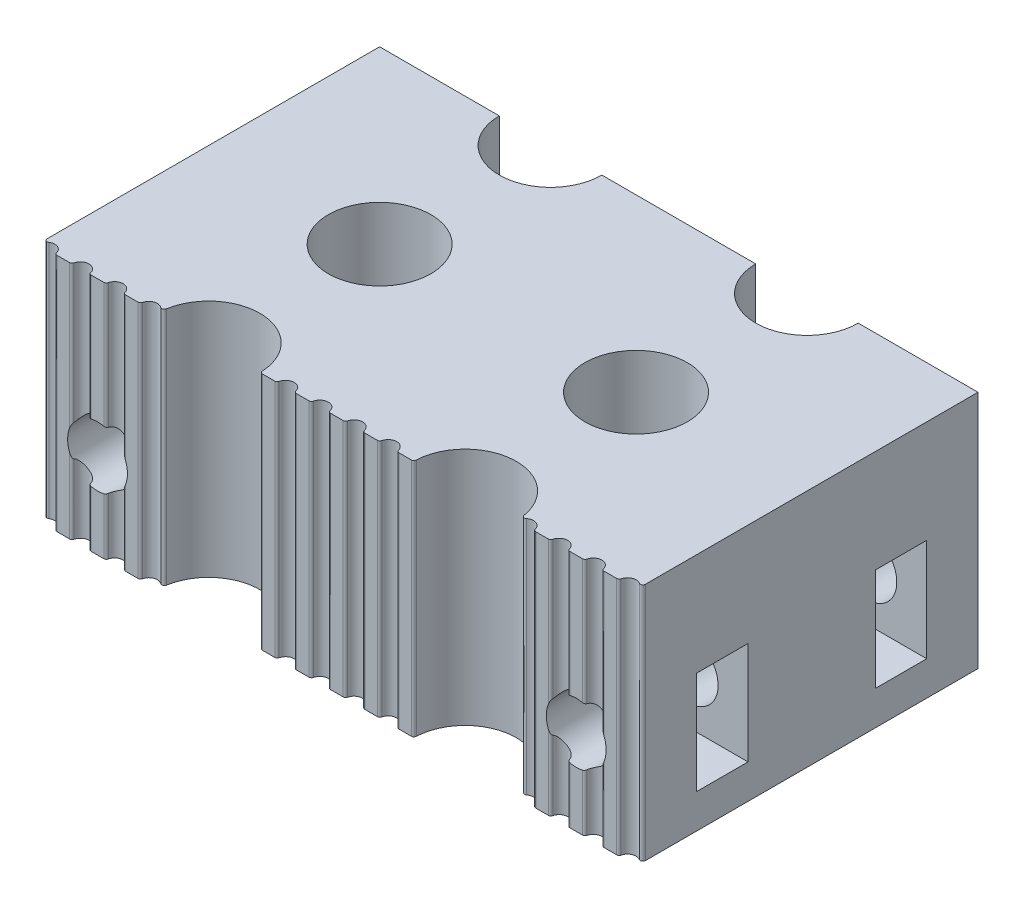
from build123d import *

# Parameters (mm, degrees)
SKETCH1_W           = 35
SKETCH1_H           = 20
BOSS_EXTRUDE1_DEPTH = 14
SKETCH2_R           = 3
CUT_EXTRUDE1_DEPTH  = 14
SKETCH3_R           = 0.5
CUT_EXTRUDE2_DEPTH  = 14
LPATTERN1_COUNT     = 18
LPATTERN1_PITCH     = 2
FILLET1_R           = 0.15
SKETCH5_R           = 1.75
CUT_EXTRUDE4_DEPTH  = 25.540782384
SKETCH7_R           = 1.75
CUT_EXTRUDE5_DEPTH  = 31.037476592
SKETCH8_R           = 3
CUT_EXTRUDE6_DEPTH  = 5
SKETCH9_W           = 3
SKETCH9_H           = 6
CUT_EXTRUDE7_DEPTH  = 7
SKETCH10_W          = 3
SKETCH10_H          = 6
CUT_EXTRUDE8_DEPTH  = 7


with BuildPart() as part:
    # Sketch1 → Boss-Extrude1 (new body)
    with BuildSketch(Plane(origin=(0, 0, 0), x_dir=(1, 0, 0), z_dir=(0, 1, 0))):
        Rectangle(SKETCH1_W, SKETCH1_H)
    extrude(amount=BOSS_EXTRUDE1_DEPTH)

    # Sketch2 → Cut-Extrude1 (cut)
    with BuildSketch(Plane(origin=(0, 14, 0), x_dir=(1, 0, 0), z_dir=(0, 1, 0))):
        with Locations((-7.5, -10)):
            Circle(SKETCH2_R)
        with Locations((7.5, -10)):
            Circle(SKETCH2_R)
        with Locations((-7.5, 10)):
            Circle(SKETCH2_R)
        with Locations((7.5, 10)):
            Circle(SKETCH2_R)
    extrude(amount=-CUT_EXTRUDE1_DEPTH, mode=Mode.SUBTRACT)

    # Sketch3 → Cut-Extrude2 (cut)
    with BuildSketch(Plane(origin=(0, 14, 0), x_dir=(1, 0, 0), z_dir=(0, 1, 0))):
        with Locations((-17, -10)):
            Circle(SKETCH3_R)
    cut_extrude2 = extrude(amount=-CUT_EXTRUDE2_DEPTH, mode=Mode.SUBTRACT)

    # LPattern1: Cut-Extrude2 ×18
    with Locations(*[(i * LPATTERN1_PITCH, 0, 0) for i in range(1, LPATTERN1_COUNT)]):
        add(cut_extrude2, mode=Mode.SUBTRACT)

    # Fillet1
    # the kernel refuses this fillet: 0.15 mm, written as the material it takes off along each edge
    with BuildSketch(Plane(origin=(-3.5, -0.33113883, 10), x_dir=(-1, 0, 0), z_dir=(0, 1, 0)), Plane(origin=(-1.5, -0.33113883, 10), x_dir=(-1, 0, 0), z_dir=(0, 1, 0)), Plane(origin=(0.5, -0.33113883, 10), x_dir=(-1, 0, 0), z_dir=(0, 1, 0)), Plane(origin=(2.5, -0.33113883, 10), x_dir=(-1, 0, 0), z_dir=(0, 1, 0)), Plane(origin=(12.5, -0.33113883, 10), x_dir=(-1, 0, 0), z_dir=(0, 1, 0)), Plane(origin=(14.5, -0.33113883, 10), x_dir=(-1, 0, 0), z_dir=(0, 1, 0)), Plane(origin=(16.5, -0.33113883, 10), x_dir=(-1, 0, 0), z_dir=(0, 1, 0)), Plane(origin=(-15.5, -0.33113883, 10), x_dir=(-1, 0, 0), z_dir=(0, 1, 0)), Plane(origin=(-13.5, -0.33113883, 10), x_dir=(-1, 0, 0), z_dir=(0, 1, 0)), Plane(origin=(-11.5, -0.33113883, 10), x_dir=(-1, 0, 0), z_dir=(0, 1, 0))) as fillet1_piece_1:
        with BuildLine():
            CenterArc((0.132455532, -0.15), FILLET1_R, 90, 76.657636203)
            ThreePointArc((-0.013495745, -0.115384615), (-0.003385397, -0.058085593), (0, 0))
            Line((0, 0), (0.132455532, 0))
        make_face()
    extrude(amount=14.66227766, mode=Mode.SUBTRACT)
    with BuildSketch(Plane(origin=(-2.5, 14.33113883, 10), x_dir=(-0.11617118657170943, 0, -0.9932292058787443), z_dir=(0, -1, 0)), Plane(origin=(-0.5, 14.33113883, 10), x_dir=(-0.11617118657171462, 0, -0.9932292058787437), z_dir=(0, -1, 0)), Plane(origin=(1.5, 14.33113883, 10), x_dir=(-0.11617118657171507, 0, -0.9932292058787436), z_dir=(0, -1, 0)), Plane(origin=(3.5, 14.33113883, 10), x_dir=(-0.11617118657170943, 0, -0.9932292058787443), z_dir=(0, -1, 0)), Plane(origin=(11.5, 14.33113883, 10), x_dir=(-0.11617118657171698, 0, -0.9932292058787435), z_dir=(0, -1, 0)), Plane(origin=(13.5, 14.33113883, 10), x_dir=(-0.11617118657171698, 0, -0.9932292058787435), z_dir=(0, -1, 0)), Plane(origin=(15.5, 14.33113883, 10), x_dir=(-0.11617118657171698, 0, -0.9932292058787435), z_dir=(0, -1, 0)), Plane(origin=(-16.5, 14.33113883, 10), x_dir=(-0.11617118657171698, 0, -0.9932292058787435), z_dir=(0, -1, 0)), Plane(origin=(-14.5, 14.33113883, 10), x_dir=(-0.11617118657171698, 0, -0.9932292058787435), z_dir=(0, -1, 0)), Plane(origin=(-12.5, 14.33113883, 10), x_dir=(-0.11617118657171698, 0, -0.9932292058787435), z_dir=(0, -1, 0))) as fillet1_piece_2:
        with BuildLine():
            CenterArc((0.133596865, 0.148984381), FILLET1_R, 186.671181899, 76.657636203)
            Line((-0.015387516, 0.131558703), (0, 0))
            ThreePointArc((0, 0), (0.058085593, 0.003385397), (0.116171187, 0))
        make_face()
    extrude(amount=14.66227766, mode=Mode.SUBTRACT)
    with BuildSketch(Plane(origin=(4.5, -0.366066361, 10), x_dir=(-1, 0, 0), z_dir=(0, 1, 0))) as fillet1_piece_3:
        with BuildLine():
            CenterArc((0.146426545, -0.15), FILLET1_R, 90, 87.270597363)
            ThreePointArc((-0.003403291, -0.142857143), (-0.000850943, -0.071448838), (0, 0))
            Line((0, 0), (0.146426545, 0))
        make_face()
    extrude(amount=14.732132723, mode=Mode.SUBTRACT)
    with BuildSketch(Plane(origin=(10.5, 15.237179148, 10), x_dir=(-0.0824786098842957, 0, -0.9965928350693448), z_dir=(0, -1, 0)), Plane(origin=(-10.5, -1.237179148, 10), x_dir=(0.08247860988429423, 0, -0.9965928350693448), z_dir=(0, 1, 0))) as fillet1_piece_4:
        with BuildLine():
            CenterArc((0.507243451, 0.149488925), FILLET1_R, 147.545688067, 117.723261309)
            ThreePointArc((0.380670507, 0.229982962), (0.21731401, 0.070335925), (0, 0))
            ThreePointArc((0, 0), (0.24743583, 0.010221495), (0.494871659, 0))
        make_face()
    extrude(amount=16.474358297, mode=Mode.SUBTRACT)
    with BuildSketch(Plane(origin=(-4.5, 14.366066361, 10), x_dir=(-0.023816279244888133, 0, -0.9997163521934256), z_dir=(0, -1, 0))) as fillet1_piece_5:
        with BuildLine():
            CenterArc((0.146470117, 0.149957453), FILLET1_R, 181.364701318, 87.270597363)
            Line((-0.003487335, 0.146385011), (0, 0))
            ThreePointArc((0, 0), (0.071448838, 0.000850943), (0.142897675, 0))
        make_face()
    extrude(amount=14.732132723, mode=Mode.SUBTRACT)
    with BuildSketch(Plane(origin=(17.5, -1.369306394, 10), x_dir=(-0.48038446141526975, 0, -0.8770580193070246), z_dir=(0, 1, 0))) as fillet1_piece_6:
        with BuildLine():
            CenterArc((0.552442131, -0.131558703), FILLET1_R, 118.710514804, 122.578970393)
            Line((0.480384461, -0.263117406), (0, 0))
            ThreePointArc((0, 0), (0.240192231, -0.06147099), (0.480384461, 0))
        make_face()
    extrude(amount=16.738612788, mode=Mode.SUBTRACT)
    with BuildSketch(Plane(origin=(-17.5, -1.369306394, 10), x_dir=(0, 0, -1), z_dir=(0, 1, 0))) as fillet1_piece_7:
        with BuildLine():
            CenterArc((0.547722558, -0.15), FILLET1_R, 90, 122.578970393)
            ThreePointArc((0.421325044, -0.230769231), (0.240192231, -0.06147099), (0, 0))
            Line((0, 0), (0.547722558, 0))
        make_face()
    extrude(amount=16.738612788, mode=Mode.SUBTRACT)

    # Sketch5 → Cut-Extrude4 (cut, through all)
    with BuildSketch(Plane(origin=(0, 14, 0), x_dir=(1, 0, 0), z_dir=(0, 1, 0))):
        with Locations(Location((-7.5, 0, 0), (0, 0, 270))):
            Circle(SKETCH5_R)
        with Locations(Location((7.5, 0, 0), (0, 0, 270))):
            Circle(SKETCH5_R)
    extrude(amount=-CUT_EXTRUDE4_DEPTH, mode=Mode.SUBTRACT)

    # Sketch7 → Cut-Extrude5 (cut, through all)
    with BuildSketch(Plane(origin=(0, 0, -10), x_dir=(-1, 0, 0), z_dir=(0, 0, -1))):
        with Locations((-14, 5)):
            Circle(SKETCH7_R)
        with Locations((14, 5)):
            Circle(SKETCH7_R)
    extrude(amount=-CUT_EXTRUDE5_DEPTH, mode=Mode.SUBTRACT)

    # Sketch8 → Cut-Extrude6 (cut)
    with BuildSketch(Plane(origin=(0, 14, 0), x_dir=(1, 0, 0), z_dir=(0, 1, 0))):
        with Locations(Location((7.5, 0, 0), (0, 0, 270))):
            Circle(SKETCH8_R)
        with Locations(Location((-7.5, 0, 0), (0, 0, 270))):
            Circle(SKETCH8_R)
    extrude(amount=-CUT_EXTRUDE6_DEPTH, mode=Mode.SUBTRACT)

    # Sketch9 → Cut-Extrude7 (cut)
    with BuildSketch(Plane(origin=(17.5, 0, 0), x_dir=(0, 0, -1), z_dir=(1, 0, 0))):
        with Locations((5.5, 5)):
            Rectangle(SKETCH9_W, SKETCH9_H)
        with Locations((-4.952277442, 5)):
            Rectangle(SKETCH9_W, SKETCH9_H)
    extrude(amount=-CUT_EXTRUDE7_DEPTH, mode=Mode.SUBTRACT)

    # Sketch10 → Cut-Extrude8 (cut)
    with BuildSketch(Plane.ZY.offset(17.5)):
        with Locations((4.952277442, 5)):
            Rectangle(SKETCH10_W, SKETCH10_H)
        with Locations((-5.5, 5)):
            Rectangle(SKETCH10_W, SKETCH10_H)
    extrude(amount=-CUT_EXTRUDE8_DEPTH, mode=Mode.SUBTRACT)


solid = part.part
